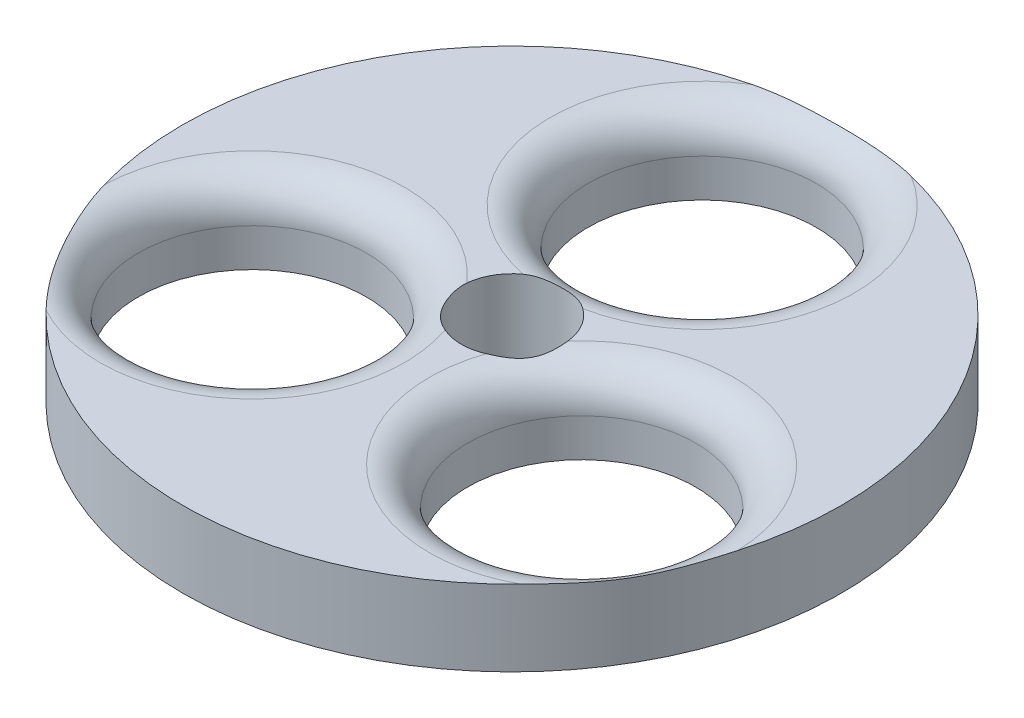
from build123d import *

# Parameters (mm, degrees)
SKETCH2_R           = 130
SKETCH2_R_2         = 45
SKETCH2_R_3         = 20
BOSS_EXTRUDE2_DEPTH = 30
FILLET1_R           = 15
SCALE1_SCALE        = 1.12


with BuildPart() as part:
    # Sketch2 → Boss-Extrude2 (new body)
    with BuildSketch(Plane(origin=(0, 0, 0), x_dir=(1, 0, 0), z_dir=(0, 1, 0))):
        with Locations(Location((0, 0, 0), (0, 0, 270))):
            Circle(SKETCH2_R)
        with Locations(Location((0, 75, 0), (0, 0, 270))):
            Circle(SKETCH2_R_2, mode=Mode.SUBTRACT)
        with Locations(Location((64.951905284, -37.5, 0), (0, 0, 270))):
            Circle(SKETCH2_R_2, mode=Mode.SUBTRACT)
        with Locations(Location((-64.951905284, -37.5, 0), (0, 0, 270))):
            Circle(SKETCH2_R_2, mode=Mode.SUBTRACT)
        with Locations(Location((0, 0, 0), (0, 0, 270))):
            Circle(SKETCH2_R_3, mode=Mode.SUBTRACT)
    extrude(amount=BOSS_EXTRUDE2_DEPTH)

    # Fillet1
    # the kernel refuses this fillet: 15 mm, written as the material it takes off along each edge
    with BuildSketch(Plane(origin=(64.951905284, 30, 37.5), x_dir=(0, 0, 1), z_dir=(-1, 0, 0))) as fillet1_piece_1:
        with BuildLine():
            CenterArc((45 + FILLET1_R, -FILLET1_R), FILLET1_R, 90, 90)
            Line((45 + FILLET1_R, 0), (45, 0))
            Line((45, 0), (45, -FILLET1_R))
        make_face()
    revolve(axis=Axis((64.951905284, 30, 37.5), (0, 1, 0)), mode=Mode.SUBTRACT)
    with BuildSketch(Plane(origin=(-64.951905284, 30, 37.5), x_dir=(0, 0, 1), z_dir=(-1, 0, 0))) as fillet1_piece_2:
        with BuildLine():
            CenterArc((45 + FILLET1_R, -FILLET1_R), FILLET1_R, 90, 90)
            Line((45 + FILLET1_R, 0), (45, 0))
            Line((45, 0), (45, -FILLET1_R))
        make_face()
    revolve(axis=Axis((-64.951905284, 30, 37.5), (0, 1, 0)), mode=Mode.SUBTRACT)
    with BuildSketch(Plane(origin=(0, 30, -75), x_dir=(0, 0, 1), z_dir=(-1, 0, 0))) as fillet1_piece_3:
        with BuildLine():
            CenterArc((45 + FILLET1_R, -FILLET1_R), FILLET1_R, 90, 90)
            Line((45 + FILLET1_R, 0), (45, 0))
            Line((45, 0), (45, -FILLET1_R))
        make_face()
    revolve(axis=Axis((0, 30, -75), (0, 1, 0)), mode=Mode.SUBTRACT)


with BuildPart() as part_1:
    # Scale1: scaled about (7.8e-08, 14.452007368, -8e-08)
    add(part.part.scale(SCALE1_SCALE).moved(Location((-9e-09, -1.734240884, 1e-08))))


solid = part_1.part
